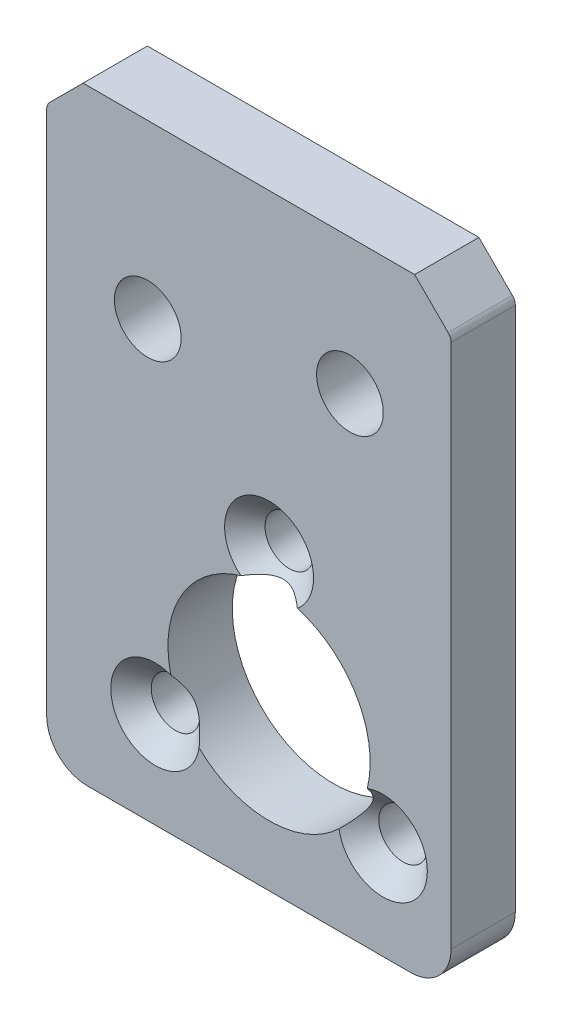
from build123d import *

# Parameters (mm, degrees)
SKETCH12_W                                      = 20
SKETCH12_H                                      = 30
SKETCH12_R                                      = 5
SKETCH12_R_2                                    = 1.65
BOSS_EXTRUDE3_DEPTH                             = 3.18
CSK_FOR_M2_FLAT_HEAD_MACHINE_SCREW2_D           = 2.4
CSK_FOR_M2_FLAT_HEAD_MACHINE_SCREW2_CSINK_D     = 4.4
CSK_FOR_M2_FLAT_HEAD_MACHINE_SCREW2_CSINK_ANGLE = 90
CHAMFER1_SIZE                                   = 1.8
FILLET3_R                                       = 0.5
FILLET4_R                                       = 2


with BuildPart() as part:
    # Sketch12 → Boss-Extrude3 (new body)
    with BuildSketch(Plane.XY):
        with Locations((-10, -15)):
            Rectangle(SKETCH12_W, SKETCH12_H)
        with Locations((-9, -22)):
            Circle(SKETCH12_R, mode=Mode.SUBTRACT)
        with Locations((-5, -6.7)):
            Circle(SKETCH12_R_2, mode=Mode.SUBTRACT)
        with Locations((-15, -8.5)):
            Circle(SKETCH12_R_2, mode=Mode.SUBTRACT)
    extrude(amount=BOSS_EXTRUDE3_DEPTH)

    # CSK for M2 Flat Head Machine Screw2 (through all)
    with Locations(Plane.XY.offset(3.18)):
        with Locations((-9, -15.49993077), (-14.62922508, -25.250034615), (-3.37077492, -25.250034615)):
            CounterSinkHole(CSK_FOR_M2_FLAT_HEAD_MACHINE_SCREW2_D / 2, CSK_FOR_M2_FLAT_HEAD_MACHINE_SCREW2_CSINK_D / 2, counter_sink_angle=CSK_FOR_M2_FLAT_HEAD_MACHINE_SCREW2_CSINK_ANGLE)

    # Chamfer1
    chamfer1_edges = [part.edges().sort_by_distance(p)[0] for p in [
        (-20, 0, 1.59),
        (0, 0, 1.59),
    ]]
    chamfer(chamfer1_edges, length=CHAMFER1_SIZE)

    # Fillet3
    fillet3_edges = [part.edges().sort_by_distance(p)[0] for p in [
        (-20, -1.8, 1.59),
        (0, -1.8, 1.59),
    ]]
    fillet(fillet3_edges, radius=FILLET3_R)

    # Fillet4
    fillet4_edges = [part.edges().sort_by_distance(p)[0] for p in [
        (-20, -30, 1.59),
        (0, -30, 1.59),
    ]]
    fillet(fillet4_edges, radius=FILLET4_R)


solid = part.part
